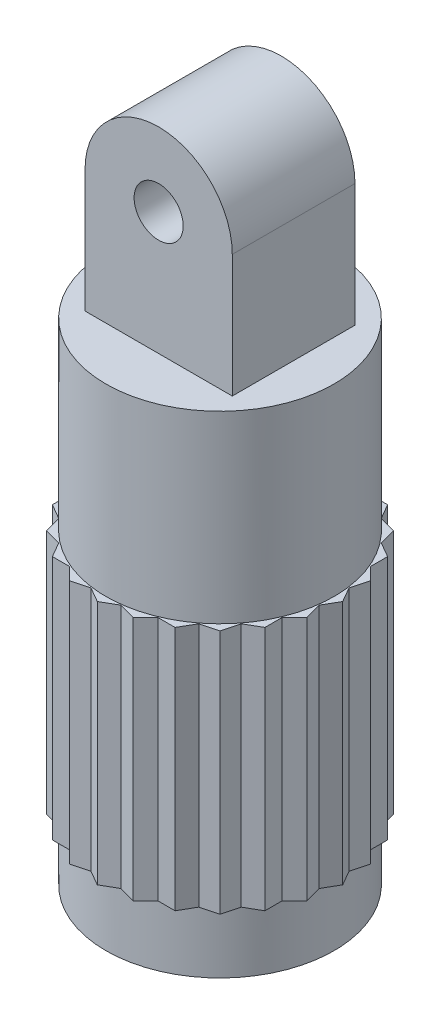
from build123d import *

# Parameters (mm, degrees)
SKETCH3_R           = 4.65
BOSS_EXTRUDE1_DEPTH = 20
SKETCH4_R           = 1
BOSS_EXTRUDE2_DEPTH = 2.5
BOSS_EXTRUDE3_START = -2.5
BOSS_EXTRUDE3_DEPTH = 10
CIRPATTERN1_COUNT   = 4
CIRPATTERN1_ANGLE   = 45


with BuildPart() as part:
    # Sketch3 → Boss-Extrude1 (new body)
    with BuildSketch(Plane(origin=(0, 0, 0), x_dir=(1, 0, 0), z_dir=(0, 1, 0))):
        Circle(SKETCH3_R)
    extrude(amount=BOSS_EXTRUDE1_DEPTH)

    # Sketch4 → Boss-Extrude2 (add, symmetric)
    with BuildSketch(Plane.XY):
        with BuildLine():
            Line((3, 20), (-3, 20))
            Line((-3, 20), (-3, 25))
            ThreePointArc((-3, 25), (0, 28), (3, 25))
            Line((3, 25), (3, 20))
        make_face()
        with Locations((0, 25)):
            Circle(SKETCH4_R, mode=Mode.SUBTRACT)
    extrude(amount=BOSS_EXTRUDE2_DEPTH, both=True)

    # Sketch5 → Boss-Extrude3 (add)
    with BuildSketch(Plane.XZ.offset(BOSS_EXTRUDE3_START)):
        Polygon((-5, 0), (-2.5, -4.330127019), (2.5, -4.330127019), (5, 0), (2.5, 4.330127019), (-2.5, 4.330127019), align=None)
    boss_extrude3 = extrude(amount=-BOSS_EXTRUDE3_DEPTH)

    # CirPattern1: Boss-Extrude3 ×4 about axis
    cirpattern1_axis = Axis((0, 20, 0), (0, -1, 0))
    for i in range(1, CIRPATTERN1_COUNT):
        add(boss_extrude3.rotate(cirpattern1_axis, i * CIRPATTERN1_ANGLE / (CIRPATTERN1_COUNT - 1)))


solid = part.part
